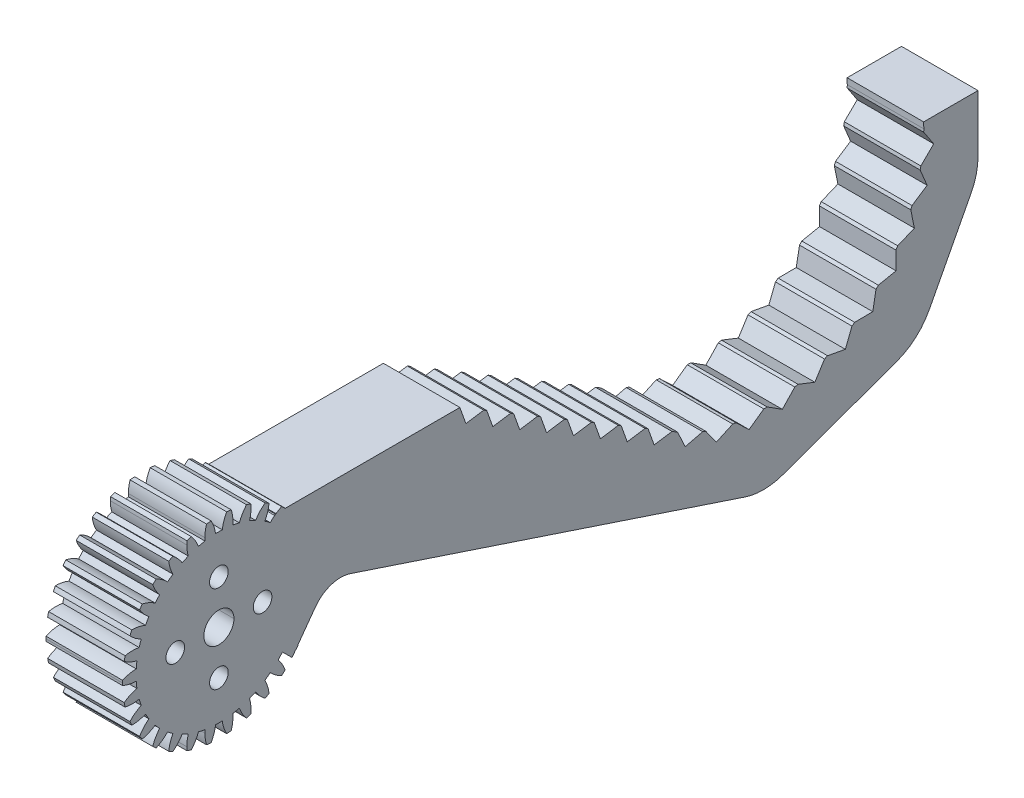
from build123d import *

# Parameters (mm, degrees)
CUT_EXTRUDE1_START       = -12.7
CUT_EXTRUDE1_OUTLINE_R   = 1.55
CUT_EXTRUDE1_OUTLINE_R_2 = 2.5
CUT_EXTRUDE1_DEPTH       = 12.7
STRAIGHT_SERRATED_DEPTH  = 130.168809679
CUT_EXTRUDE5_DEPTH       = 130.168809679
CIRPATTERN1_COUNT        = 11
CIRPATTERN1_ANGLE        = 110
LPATTERN1_COUNT          = 8
LPATTERN1_PITCH          = 5.2


with BuildPart() as part:
    # Cut-Extrude1: read off the stored shape, not the designer's step
    # Cut-Extrude1 outline → Cut-Extrude1 (new body)
    with BuildSketch(Plane(origin=(12.7, 0, 0), x_dir=(0, 0, -1), z_dir=(1, 0, 0)).offset(CUT_EXTRUDE1_START)):
        with BuildLine():
            ThreePointArc((12.717729357, 9.708725972), (12.692209951, 9.703070666), (12.666715424, 9.69730424))
            Line((12.666715424, 9.69730424), (12.140731629, 10.421258825))
            Line((12.140731629, 10.421258825), (10.543658842, 8.824186038))
            ThreePointArc((10.543658842, 8.824186038), (10.197144346, 9.222431793), (9.835597405, 9.607082007))
            ThreePointArc((9.835597405, 9.607082007), (10.509522814, 10.563841291), (10.984905261, 11.633222099))
            ThreePointArc((10.984905261, 11.633222099), (10.706089702, 11.890317208), (10.421258825, 12.140731629))
            ThreePointArc((10.421258825, 12.140731629), (9.407427193, 11.556172645), (8.526353524, 10.785930492))
            ThreePointArc((8.526353524, 10.785930492), (8.081459434, 11.123174656), (7.62324134, 11.442079902))
            ThreePointArc((7.62324134, 11.442079902), (8.083518421, 12.518048671), (8.326175849, 13.662898511))
            ThreePointArc((8.326175849, 13.662898511), (8, 13.856406461), (7.669329276, 14.042129057))
            ThreePointArc((7.669329276, 14.042129057), (6.799188944, 13.25955664), (6.097511197, 12.32296061))
            ThreePointArc((6.097511197, 12.32296061), (5.592222105, 12.560336497), (5.077713047, 12.777004))
            ThreePointArc((5.077713047, 12.777004), (5.304225484, 13.925157256), (5.303552599, 15.095440697))
            ThreePointArc((5.303552599, 15.095440697), (4.94427191, 15.216904261), (4.582213235, 15.329818064))
            ThreePointArc((4.582213235, 15.329818064), (3.893793512, 14.383434384), (3.402178372, 13.321418218))
            ThreePointArc((3.402178372, 13.321418218), (2.858577837, 13.448551362), (2.310264329, 13.553511712))
            ThreePointArc((2.310264329, 13.553511712), (2.293112441, 14.723669649), (2.049138651, 15.868239688))
            ThreePointArc((2.049138651, 15.868239688), (1.672455412, 15.912350326), (1.294832488, 15.94752046))
            ThreePointArc((1.294832488, 15.94752046), (0.818220619, 14.878687026), (0.558154026, 13.737665926))
            ThreePointArc((0.558154026, 13.737665926), (0, 13.749), (-0.558154026, 13.737665926))
            ThreePointArc((-0.558154026, 13.737665926), (-0.818220619, 14.878687026), (-1.294832488, 15.94752046))
            ThreePointArc((-1.294832488, 15.94752046), (-1.672455412, 15.912350326), (-2.049138651, 15.868239688))
            ThreePointArc((-2.049138651, 15.868239688), (-2.260064036, 14.970515845), (-2.330930504, 14.051072775))
            ThreePointArc((-2.330930504, 14.051072775), (-2.325761734, 13.802077744), (-2.310264329, 13.553511712))
            ThreePointArc((-2.310264329, 13.553511712), (-2.858577837, 13.448551362), (-3.402178372, 13.321418218))
            ThreePointArc((-3.402178372, 13.321418218), (-3.893793512, 14.383434384), (-4.582213235, 15.329818064))
            ThreePointArc((-4.582213235, 15.329818064), (-4.94427191, 15.216904261), (-5.303552599, 15.095440697))
            ThreePointArc((-5.303552599, 15.095440697), (-5.325251864, 14.801508613), (-5.332490774, 14.506865565))
            ThreePointArc((-5.332490774, 14.506865565), (-5.268454624, 13.632604059), (-5.077713047, 12.777004))
            ThreePointArc((-5.077713047, 12.777004), (-5.592222105, 12.560336497), (-6.097511197, 12.32296061))
            ThreePointArc((-6.097511197, 12.32296061), (-6.799188944, 13.25955664), (-7.669329276, 14.042129057))
            ThreePointArc((-7.669329276, 14.042129057), (-8, 13.856406461), (-8.326175849, 13.662898511))
            ThreePointArc((-8.326175849, 13.662898511), (-8.083518421, 12.518048671), (-7.62324134, 11.442079902))
            ThreePointArc((-7.62324134, 11.442079902), (-8.081459434, 11.123174656), (-8.526353524, 10.785930492))
            ThreePointArc((-8.526353524, 10.785930492), (-9.407427193, 11.556172645), (-10.421258825, 12.140731629))
            ThreePointArc((-10.421258825, 12.140731629), (-10.706089702, 11.890317208), (-10.984905261, 11.633222099))
            ThreePointArc((-10.984905261, 11.633222099), (-10.509522814, 10.563841291), (-9.835597405, 9.607082007))
            ThreePointArc((-9.835597405, 9.607082007), (-10.217498205, 9.199876707), (-10.582553288, 8.777503455))
            ThreePointArc((-10.582553288, 8.777503455), (-11.604515732, 9.347728452), (-12.717729357, 9.708725972))
            ThreePointArc((-12.717729357, 9.708725972), (-12.94427191, 9.404564037), (-13.163541602, 9.095118059))
            ThreePointArc((-13.163541602, 9.095118059), (-12.47621063, 8.147943355), (-11.618090667, 7.352208528))
            ThreePointArc((-11.618090667, 7.352208528), (-11.906983277, 6.8745), (-12.176244693, 6.385457397))
            ThreePointArc((-12.176244693, 6.385457397), (-13.294431249, 6.730743671), (-14.45837409, 6.852402401))
            ThreePointArc((-14.45837409, 6.852402401), (-14.616727322, 6.507786289), (-14.766868009, 6.159513716))
            ThreePointArc((-14.766868009, 6.159513716), (-13.897628173, 5.375941197), (-12.892817618, 4.776008257))
            ThreePointArc((-12.892817618, 4.776008257), (-13.076076043, 4.248674656), (-13.237775777, 3.714336211))
            ThreePointArc((-13.237775777, 3.714336211), (-14.403316326, 3.819593093), (-15.567118496, 3.696595965))
            ThreePointArc((-15.567118496, 3.696595965), (-15.650361612, 3.326587053), (-15.724811424, 2.954709067))
            ThreePointArc((-15.724811424, 2.954709067), (-14.711652678, 2.368984611), (-13.604066572, 1.991073508))
            ThreePointArc((-13.604066572, 1.991073508), (-13.673681539, 1.437161841), (-13.720752537, 0.880880708))
            ThreePointArc((-13.720752537, 0.880880708), (-14.882707366, 0.741507969), (-15.995505125, 0.379230546))
            ThreePointArc((-15.995505125, 0.379230546), (-15.998876242, 0.189628592), (-16, 0))
            ThreePointArc((-16, 0), (-15.998876242, -0.189628592), (-15.995505125, -0.379230546))
            ThreePointArc((-15.995505125, -0.379230546), (-14.882707366, -0.741507969), (-13.720752537, -0.880880708))
            ThreePointArc((-13.720752537, -0.880880708), (-13.673681539, -1.437161841), (-13.604066572, -1.991073508))
            ThreePointArc((-13.604066572, -1.991073508), (-14.711652678, -2.368984611), (-15.724811424, -2.954709067))
            ThreePointArc((-15.724811424, -2.954709067), (-15.650361612, -3.326587053), (-15.567118496, -3.696595965))
            ThreePointArc((-15.567118496, -3.696595965), (-14.403316326, -3.819593093), (-13.237775777, -3.714336211))
            ThreePointArc((-13.237775777, -3.714336211), (-13.076076043, -4.248674656), (-12.892817618, -4.776008257))
            ThreePointArc((-12.892817618, -4.776008257), (-13.897628173, -5.375941197), (-14.766868009, -6.159513716))
            ThreePointArc((-14.766868009, -6.159513716), (-14.616727322, -6.507786289), (-14.45837409, -6.852402401))
            ThreePointArc((-14.45837409, -6.852402401), (-13.294431249, -6.730743671), (-12.176244693, -6.385457397))
            ThreePointArc((-12.176244693, -6.385457397), (-11.906983277, -6.8745), (-11.618090667, -7.352208528))
            ThreePointArc((-11.618090667, -7.352208528), (-12.47621063, -8.147943355), (-13.163541602, -9.095118059))
            ThreePointArc((-13.163541602, -9.095118059), (-12.94427191, -9.404564037), (-12.717729357, -9.708725972))
            ThreePointArc((-12.717729357, -9.708725972), (-11.604515732, -9.347728452), (-10.582553288, -8.777503455))
            ThreePointArc((-10.582553288, -8.777503455), (-10.217498205, -9.199876707), (-9.835597405, -9.607082007))
            ThreePointArc((-9.835597405, -9.607082007), (-10.509522814, -10.563841291), (-10.984905261, -11.633222099))
            ThreePointArc((-10.984905261, -11.633222099), (-10.706089702, -11.890317208), (-10.421258825, -12.140731629))
            ThreePointArc((-10.421258825, -12.140731629), (-9.407427193, -11.556172645), (-8.526353524, -10.785930492))
            ThreePointArc((-8.526353524, -10.785930492), (-8.081459434, -11.123174656), (-7.62324134, -11.442079902))
            ThreePointArc((-7.62324134, -11.442079902), (-8.083518421, -12.518048671), (-8.326175849, -13.662898511))
            ThreePointArc((-8.326175849, -13.662898511), (-8, -13.856406461), (-7.669329276, -14.042129057))
            ThreePointArc((-7.669329276, -14.042129057), (-6.799188944, -13.25955664), (-6.097511197, -12.32296061))
            ThreePointArc((-6.097511197, -12.32296061), (-5.592222105, -12.560336497), (-5.077713047, -12.777004))
            ThreePointArc((-5.077713047, -12.777004), (-5.268454624, -13.632604059), (-5.332490774, -14.506865565))
            ThreePointArc((-5.332490774, -14.506865565), (-5.325251864, -14.801508613), (-5.303552599, -15.095440697))
            ThreePointArc((-5.303552599, -15.095440697), (-4.94427191, -15.216904261), (-4.582213235, -15.329818064))
            ThreePointArc((-4.582213235, -15.329818064), (-3.893793512, -14.383434384), (-3.402178372, -13.321418218))
            ThreePointArc((-3.402178372, -13.321418218), (-2.858577837, -13.448551362), (-2.310264329, -13.553511712))
            ThreePointArc((-2.310264329, -13.553511712), (-2.325761734, -13.802077744), (-2.330930504, -14.051072775))
            ThreePointArc((-2.330930504, -14.051072775), (-2.260064036, -14.970515845), (-2.049138651, -15.868239688))
            ThreePointArc((-2.049138651, -15.868239688), (-1.672455412, -15.912350326), (-1.294832488, -15.94752046))
            ThreePointArc((-1.294832488, -15.94752046), (-0.818220619, -14.878687026), (-0.558154026, -13.737665926))
            ThreePointArc((-0.558154026, -13.737665926), (0, -13.749), (0.558154026, -13.737665926))
            ThreePointArc((0.558154026, -13.737665926), (0.818220619, -14.878687026), (1.294832488, -15.94752046))
            ThreePointArc((1.294832488, -15.94752046), (1.672455412, -15.912350326), (2.049138651, -15.868239688))
            ThreePointArc((2.049138651, -15.868239688), (2.293112441, -14.723669649), (2.310264329, -13.553511712))
            ThreePointArc((2.310264329, -13.553511712), (2.858577837, -13.448551362), (3.402178372, -13.321418218))
            ThreePointArc((3.402178372, -13.321418218), (3.893793512, -14.383434384), (4.582213235, -15.329818064))
            ThreePointArc((4.582213235, -15.329818064), (4.94427191, -15.216904261), (5.303552599, -15.095440697))
            ThreePointArc((5.303552599, -15.095440697), (5.304225484, -13.925157256), (5.077713047, -12.777004))
            ThreePointArc((5.077713047, -12.777004), (5.592222105, -12.560336497), (6.097511197, -12.32296061))
            ThreePointArc((6.097511197, -12.32296061), (6.799188944, -13.25955664), (7.669329276, -14.042129057))
            ThreePointArc((7.669329276, -14.042129057), (8, -13.856406461), (8.326175849, -13.662898511))
            ThreePointArc((8.326175849, -13.662898511), (8.083518421, -12.518048671), (7.62324134, -11.442079902))
            ThreePointArc((7.62324134, -11.442079902), (8.081459434, -11.123174656), (8.526353524, -10.785930492))
            ThreePointArc((8.526353524, -10.785930492), (8.879560502, -11.131767057), (9.260037221, -11.447354708))
            Line((9.260037221, -11.447354708), (9.347728452, -11.604515732))
            Line((9.347728452, -11.604515732), (9.476052331, -11.604515732))
            ThreePointArc((9.476052331, -11.604515732), (9.936490748, -11.894067052), (10.421258825, -12.140731629))
            ThreePointArc((10.421258825, -12.140731629), (10.706089702, -11.890317208), (10.984905261, -11.633222099))
            ThreePointArc((10.984905261, -11.633222099), (10.980116676, -11.618862852), (10.975291881, -11.604515732))
            Line((10.975291881, -11.604515732), (40, -11.604515732))
            Line((40, -11.604515732), (76.142534504, 10.00908557))
            ThreePointArc((76.142534504, 10.00908557), (103.320068161, 10.322109), (117, -13.163541602))
            ThreePointArc((117, -13.163541602), (116.995368384, -13.663627387), (116.981475126, -14.163541602))
            Line((116.981475126, -14.163541602), (126.002623122, -14.163541602))
            Line((126.002623122, -14.163541602), (126.002623122, -4.621236917))
            ThreePointArc((126.002623122, -4.621236917), (125.713637457, -2.234565473), (124.863383006, 0.014163204))
            Line((124.863383006, 0.014163204), (117.910282824, 13.30530303))
            ThreePointArc((117.910282824, 13.30530303), (115.623862399, 16.205024717), (112.440958193, 18.077249342))
            Line((112.440958193, 18.077249342), (93.626265326, 24.860119848))
            ThreePointArc((93.626265326, 24.860119848), (90.494176934, 25.428140839), (87.348570601, 24.940507427))
            Line((87.348570601, 24.940507427), (21.859952636, 3.2094026))
            ThreePointArc((21.859952636, 3.2094026), (18.630790376, 3.194295073), (16.015357814, 5.088293396))
            Line((16.015357814, 5.088293396), (13.136914717, 9.050130434))
            ThreePointArc((13.136914717, 9.050130434), (13.150277156, 9.072595247), (13.163541602, 9.095118059))
            ThreePointArc((13.163541602, 9.095118059), (12.94427191, 9.404564037), (12.717729357, 9.708725972))
        make_face()
        with Locations((0, -7.249999978)):
            Circle(CUT_EXTRUDE1_OUTLINE_R, mode=Mode.SUBTRACT)
        with Locations((-7.249999978, 0)):
            Circle(CUT_EXTRUDE1_OUTLINE_R, mode=Mode.SUBTRACT)
        Circle(CUT_EXTRUDE1_OUTLINE_R_2, mode=Mode.SUBTRACT)
        with Locations((7.249999978, 0)):
            Circle(CUT_EXTRUDE1_OUTLINE_R, mode=Mode.SUBTRACT)
        with Locations((0, 7.249999978)):
            Circle(CUT_EXTRUDE1_OUTLINE_R, mode=Mode.SUBTRACT)
    extrude(amount=CUT_EXTRUDE1_DEPTH)

    # Sketch2 → Straight serrated (cut, through all)
    with BuildSketch(Plane(origin=(12.7, 0, 0), x_dir=(0, 0, -1), z_dir=(1, 0, 0))):
        Polygon((40, -11.604515732), (41.005695994, -8.778108902), (43.971543756, -9.229492384), align=None)
    straight_serrated = extrude(amount=-STRAIGHT_SERRATED_DEPTH, mode=Mode.SUBTRACT)

    # Sketch3 → Cut-Extrude5 (cut, symmetric)
    with BuildSketch(Plane(origin=(12.7, 0, 0), x_dir=(0, 0, -1), z_dir=(1, 0, 0))):
        with BuildLine():
            Line((77.386739139, 12.738912456), (76.142534504, 10.00908557))
            ThreePointArc((76.142534504, 10.00908557), (78.179281884, 11.111355375), (80.302995674, 12.035031912))
            Line((80.302995674, 12.035031912), (77.386739139, 12.738912456))
        make_face()
    cut_extrude5 = extrude(amount=CUT_EXTRUDE5_DEPTH, both=True, mode=Mode.SUBTRACT)

    # CirPattern1: Cut-Extrude5 ×11 about axis
    cirpattern1_axis = Axis((0, -13.163541602, -90), (-1, 0, 0))
    for i in range(1, CIRPATTERN1_COUNT):
        add(cut_extrude5.rotate(cirpattern1_axis, i * CIRPATTERN1_ANGLE / (CIRPATTERN1_COUNT - 1)), mode=Mode.SUBTRACT)

    # LPattern1: Straight serrated ×8
    with Locations(*[Vector(0, 0.5132394627986414, -0.8582454508042335) * (i * LPATTERN1_PITCH) for i in range(1, LPATTERN1_COUNT)]):
        add(straight_serrated, mode=Mode.SUBTRACT)


with BuildPart() as body_2:
    # Mirror1: mirrored copy
    add(part.part.mirror(Plane(origin=(0, -21.604515732, 0), x_dir=(0, 0, 1), z_dir=(0, -1, 0))))


solid = body_2.part
